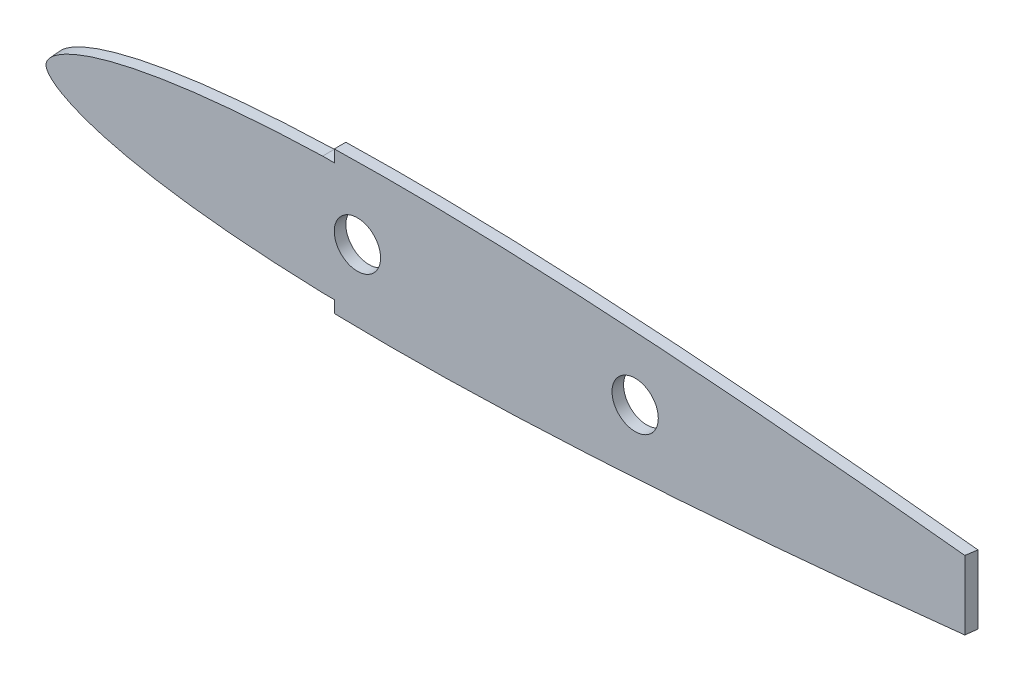
from build123d import *

# Parameters (mm, degrees)
BOSS_EXTRUDE1_DEPTH     = 3.175
SKETCH2_R               = 6.35
CUT_EXTRUDE1_DEPTH      = 330.685208226
CUT_EXTRUDE2_DEPTH      = 330.685208226
CUT_EXTRUDE2_DEPTH_BACK = 330.685208226


with BuildPart() as part:
    # Sketch1 → Boss-Extrude1 (new body)
    with BuildSketch(Plane.XY):
        with BuildLine():
            add(Edge.make_bspline(
                [(328.93, 0.4144518), (328.807900642, 0.516772717), (328.019000541, 0.420161926), (326.614170865, 0.815622818), (324.037900124, 1.060053788), (320.567272172, 1.584632638), (316.096583479, 2.170027594), (310.705215164, 2.891499965), (304.407193949, 3.70705594), (297.248126622, 4.61507178), (289.269853683, 5.599640546), (280.522284399, 6.647437516), (271.05918713, 7.745466949), (260.938835986, 8.878779448), (250.223661724, 10.033538187), (238.979802735, 11.195400912), (227.276553794, 12.349370833), (215.186101231, 13.479249677), (202.78290329, 14.570204468), (190.143565404, 15.603996393), (177.345750776, 16.563769435), (164.468478458, 17.43170464), (151.591090461, 18.189654233), (138.792862913, 18.818469572), (126.15283726, 19.301382712), (113.748578816, 19.622639213), (101.656743367, 19.766547691), (89.951630239, 19.721687508), (78.705404506, 19.479393557), (67.987291822, 19.033523951), (57.863264224, 18.382912366), (48.395544354, 17.529516447), (39.642067919, 16.480001255), (31.656190162, 15.24329661), (24.486303571, 13.832318834), (18.174431838, 12.263022231), (12.756441756, 10.550709399), (8.259860269, 8.711328155), (4.699027102, 6.757322776), (2.079421527, 4.684836659), (0.401585469, 2.443731656), (-0.187153107, 0), (0.401585469, -2.443731656), (2.079421527, -4.684836659), (4.699027102, -6.757322776), (8.259860269, -8.711328155), (12.756441756, -10.550709399), (18.174431838, -12.263022231), (24.486303571, -13.832318834), (31.656190162, -15.24329661), (39.642067919, -16.480001255), (48.395544354, -17.529516447), (57.863264224, -18.382912366), (67.987291822, -19.033523951), (78.705404506, -19.479393557), (89.951630239, -19.721687508), (101.656743367, -19.766547691), (113.748578816, -19.622639213), (126.15283726, -19.301382712), (138.792862913, -18.818469572), (151.591090461, -18.189654233), (164.468478458, -17.43170464), (177.345750776, -16.563769435), (190.143565404, -15.603996393), (202.78290329, -14.570204468), (215.186101231, -13.479249677), (227.276553794, -12.349370833), (238.979802735, -11.195400912), (250.223661724, -10.033538187), (260.938835986, -8.878779448), (271.05918713, -7.745466949), (280.522284399, -6.647437516), (289.269853683, -5.599640546), (297.248126622, -4.61507178), (304.407193949, -3.70705594), (310.705215164, -2.891499965), (316.096583479, -2.170027594), (320.567272172, -1.584632638), (324.037900124, -1.060053788), (326.614170865, -0.815622818), (328.019000541, -0.420161926), (329.127736254, -0.555940631), (329.127736254, 0.24874614), (328.93, 0.4144518)],
                knots=[0, 0, 0, 0, 0.000762215, 0.003044706, 0.006832246, 0.012101176, 0.018817536, 0.026939455, 0.036414848, 0.047184629, 0.059180413, 0.072327874, 0.086544061, 0.10174058, 0.117823336, 0.134691452, 0.152240154, 0.17036129, 0.188941008, 0.207865435, 0.227016078, 0.246275696, 0.265524943, 0.284644966, 0.303520118, 0.322034575, 0.340078353, 0.357542593, 0.374325482, 0.390329891, 0.40546389, 0.419643801, 0.432793371, 0.444843817, 0.455737921, 0.465428653, 0.47388632, 0.481101634, 0.487101684, 0.491975368, 0.495930678, 0.499382808, 0.502834938, 0.506790248, 0.511663932, 0.517663982, 0.524879296, 0.533336963, 0.543027695, 0.553921799, 0.565972245, 0.579121815, 0.593301726, 0.608435725, 0.624440134, 0.641223023, 0.658687263, 0.676731041, 0.695245498, 0.71412065, 0.733240673, 0.75248992, 0.771749538, 0.790900181, 0.809824608, 0.828404326, 0.846525462, 0.864074164, 0.88094228, 0.897025036, 0.912221555, 0.926437743, 0.939585203, 0.951580988, 0.962350768, 0.971826161, 0.979948081, 0.98666444, 0.991933371, 0.99572091, 0.998003402, 0.998765616, 1, 1, 1, 1], degree=3))
        make_face()
    extrude(amount=BOSS_EXTRUDE1_DEPTH)

    # Sketch2 → Cut-Extrude1 (cut, through all)
    with BuildSketch(Plane.XY.offset(3.175)):
        with Locations((88.9, 0)):
            Circle(SKETCH2_R)
        with Locations((165.1, 0)):
            Circle(SKETCH2_R)
    extrude(amount=-CUT_EXTRUDE1_DEPTH, mode=Mode.SUBTRACT)

    # Sketch3 → Cut-Extrude2 (cut, two sides: drawn at the far end of the back side and taken through both)
    with BuildSketch(Plane(origin=(0, 0, 0), x_dir=(1, 0, 0), z_dir=(0, 1, 0)).offset(-CUT_EXTRUDE2_DEPTH_BACK)):
        Polygon((255.992242673, 0), (255.545593987, -3.175), (329.07830219, -3.175), (329.07830219, 0), align=None)
    extrude(amount=CUT_EXTRUDE2_DEPTH + CUT_EXTRUDE2_DEPTH_BACK, mode=Mode.SUBTRACT)

    # Sketch4 → Cut-Loft1 section 0
    with BuildSketch(Plane.XY.offset(3.175)):
        with BuildLine():
            Line((82.55, -19.515708197), (82.55, -16.251023077))
            Line((82.55, -16.251023077), (79.375, -16.251023077))
            add(Edge.make_bspline(
                [(79.375, 16.251023077), (72.770318552, 16.048049675), (66.176202719, 15.728304371), (56.30738853, 15.001567412), (53.021532705, 14.717888762), (46.459157571, 14.04734399), (43.182596705, 13.660937457), (38.276882967, 12.980450934), (36.643177419, 12.736779299), (33.379494145, 12.209172355), (31.748117674, 11.925180268), (28.498717967, 11.31067673), (26.880571377, 10.97988905), (23.660292552, 10.260780921), (22.058116365, 9.87261787), (18.875212279, 9.019251619), (17.293996052, 8.555526619), (14.162834442, 7.517257926), (12.611952901, 6.946125273), (10.325000489, 5.950076454), (9.567811499, 5.594025093), (8.461932827, 5.017489815), (8.097932617, 4.81777412), (7.381669561, 4.39922172), (7.029407018, 4.180395983), (6.339282138, 3.719594292), (6.001169966, 3.47795005), (5.346762375, 2.959692647), (5.02857237, 2.681117584), (4.439349211, 2.084395549), (4.164695388, 1.768387828), (3.820228536, 1.236176286), (3.718740433, 1.050561172), (3.59999989, 0.759299745), (3.565442077, 0.659141625), (3.509216677, 0.455376556), (3.487522742, 0.351764773), (3.459675736, 0.143592536), (3.453573255, 0.038940089), (3.461444597, -0.171798071), (3.474973766, -0.278422694), (3.536160139, -0.588423887), (3.603651886, -0.78636311), (3.780189655, -1.168677669), (3.889538593, -1.351988295), (4.129382817, -1.699026003), (4.261329389, -1.864987348), (4.67775825, -2.342961513), (4.979594961, -2.63427888), (5.614334641, -3.181856059), (5.947755344, -3.437548737), (6.980186178, -4.167859174), (7.695486627, -4.59881642), (9.156342741, -5.391257516), (9.902423269, -5.75319572), (11.414841066, -6.432708068), (12.181579116, -6.749404985), (13.73156777, -7.346635451), (14.514836956, -7.627179806), (16.093189665, -8.161972373), (16.88860874, -8.415184993), (18.482918694, -8.896317804), (19.282763312, -9.124717403), (21.688920309, -9.779957105), (23.302005405, -10.176164111), (26.541461257, -10.908476052), (28.167798474, -11.244732377), (33.062961618, -12.180447863), (36.350545365, -12.709560737), (42.938422768, -13.630876096), (46.23811967, -14.02274496), (52.84624923, -14.702163706), (56.154743063, -14.989298509), (66.090451195, -15.724271447), (72.727906329, -16.046777883), (79.375, -16.251023077)],
                knots=[0, 0, 0, 0, 0.125, 0.125, 0.1875, 0.1875, 0.25, 0.25, 0.28125, 0.28125, 0.3125, 0.3125, 0.34375, 0.34375, 0.375, 0.375, 0.40625, 0.40625, 0.4375, 0.4375, 0.453125, 0.453125, 0.4609375, 0.4609375, 0.46875, 0.46875, 0.4765625, 0.4765625, 0.484375, 0.484375, 0.4921875, 0.4921875, 0.49609375, 0.49609375, 0.498046875, 0.498046875, 0.5, 0.5, 0.501953125, 0.501953125, 0.50390625, 0.50390625, 0.5078125, 0.5078125, 0.51171875, 0.51171875, 0.515625, 0.515625, 0.5234375, 0.5234375, 0.53125, 0.53125, 0.546875, 0.546875, 0.5625, 0.5625, 0.578125, 0.578125, 0.59375, 0.59375, 0.609375, 0.609375, 0.625, 0.625, 0.65625, 0.65625, 0.6875, 0.6875, 0.75, 0.75, 0.8125, 0.8125, 0.875, 0.875, 1, 1, 1, 1], degree=3))
            Line((79.375, 16.251023077), (82.55, 16.251023077))
            Line((82.55, 16.251023077), (82.55, 19.515708197))
            Line((82.55, 19.515708197), (82.55, 26.856724286))
            Line((82.55, 26.856724286), (0.541465363, 30.021162049))
            Line((0.541465363, 30.021162049), (-2.146488993, -32.850745924))
            Line((-2.146488993, -32.850745924), (82.55, -25.525605715))
            Line((82.55, -25.525605715), (82.55, -19.515708197))
        make_face()
    # Sketch5 → Cut-Loft1 section 1
    with BuildSketch(Plane(origin=(0, 0, 0), x_dir=(-1, 0, 0), z_dir=(0, 0, -1))):
        with BuildLine():
            Line((-82.55, 16.286875084), (-82.55, 19.550482394))
            Line((-82.55, 19.550482394), (-82.55, 31.358919225))
            Line((-82.55, 31.358919225), (6.781155494, 29.861379368))
            Line((6.781155494, 29.861379368), (6.781155494, -36.639095207))
            Line((6.781155494, -36.639095207), (-82.55, -25.525605715))
            Line((-82.55, -25.525605715), (-82.55, -19.550482394))
            Line((-82.55, -19.550482394), (-82.55, -16.286875084))
            Line((-82.55, -16.286875084), (-79.375, -16.286825084))
            add(Edge.make_bspline(
                [(-79.375, -16.286825084), (-72.70273318, -16.083625481), (-66.040162391, -15.761734789), (-56.066904089, -15.02675589), (-52.74593973, -14.739468648), (-46.112636154, -14.059312037), (-42.800262288, -13.666866819), (-36.186801437, -12.743811384), (-32.886327655, -12.2135267), (-27.972128974, -11.275498707), (-26.339484745, -10.938349054), (-23.087489601, -10.204046758), (-21.46817298, -9.806739324), (-19.052762163, -9.149552861), (-18.249847199, -8.920461216), (-16.649429662, -8.437847637), (-15.850951917, -8.18383552), (-13.474510425, -7.379098548), (-11.914239449, -6.789912299), (-9.637231735, -5.767068515), (-8.888396164, -5.403819393), (-7.422171814, -4.608342986), (-6.704241471, -4.175660987), (-5.668127182, -3.442181611), (-5.333636046, -3.185395684), (-4.696951467, -2.635333166), (-4.394240594, -2.342641179), (-3.976788262, -1.862235899), (-3.844582818, -1.695403026), (-3.604511152, -1.346529706), (-3.495161032, -1.162204789), (-3.319211947, -0.777827241), (-3.252263911, -0.578820545), (-3.192281327, -0.267197855), (-3.179223041, -0.160018081), (-3.172509862, 0.051695952), (-3.179309615, 0.15678123), (-3.223308922, 0.470243795), (-3.283913969, 0.67718865), (-3.444877784, 1.066367796), (-3.547583565, 1.252275918), (-3.89542395, 1.785311832), (-4.171725698, 2.101726419), (-4.764220619, 2.699573748), (-5.08404298, 2.978749304), (-5.741470891, 3.497921226), (-6.081013127, 3.739966717), (-7.120428348, 4.432428384), (-7.84199373, 4.847705574), (-9.322334636, 5.617984146), (-10.082577048, 5.974865708), (-12.378451328, 6.97306267), (-13.935068025, 7.545295509), (-17.077417964, 8.585489689), (-18.664115765, 9.049996772), (-21.858212178, 9.904877668), (-23.466047551, 10.293687362), (-26.697720209, 11.014001073), (-28.321602434, 11.345344154), (-31.582558999, 11.960787009), (-33.219741649, 12.245183343), (-36.494895711, 12.773474887), (-38.134297303, 13.017428152), (-43.057081916, 13.69860264), (-46.345031773, 14.085282453), (-52.93019877, 14.756080578), (-56.227457948, 15.039733656), (-66.130500011, 15.766027755), (-72.74745852, 16.084987562), (-79.375, 16.286825084)],
                knots=[0, 0, 0, 0, 0.125, 0.125, 0.1875, 0.1875, 0.25, 0.25, 0.3125, 0.3125, 0.34375, 0.34375, 0.375, 0.375, 0.390625, 0.390625, 0.40625, 0.40625, 0.4375, 0.4375, 0.453125, 0.453125, 0.46875, 0.46875, 0.4765625, 0.4765625, 0.484375, 0.484375, 0.48828125, 0.48828125, 0.4921875, 0.4921875, 0.49609375, 0.49609375, 0.498046875, 0.498046875, 0.5, 0.5, 0.50390625, 0.50390625, 0.5078125, 0.5078125, 0.515625, 0.515625, 0.5234375, 0.5234375, 0.53125, 0.53125, 0.546875, 0.546875, 0.5625, 0.5625, 0.59375, 0.59375, 0.625, 0.625, 0.65625, 0.65625, 0.6875, 0.6875, 0.71875, 0.71875, 0.75, 0.75, 0.8125, 0.8125, 0.875, 0.875, 1, 1, 1, 1], degree=3))
            Line((-79.375, 16.286825084), (-82.55, 16.286875084))
        make_face()
    loft(mode=Mode.SUBTRACT)


solid = part.part
